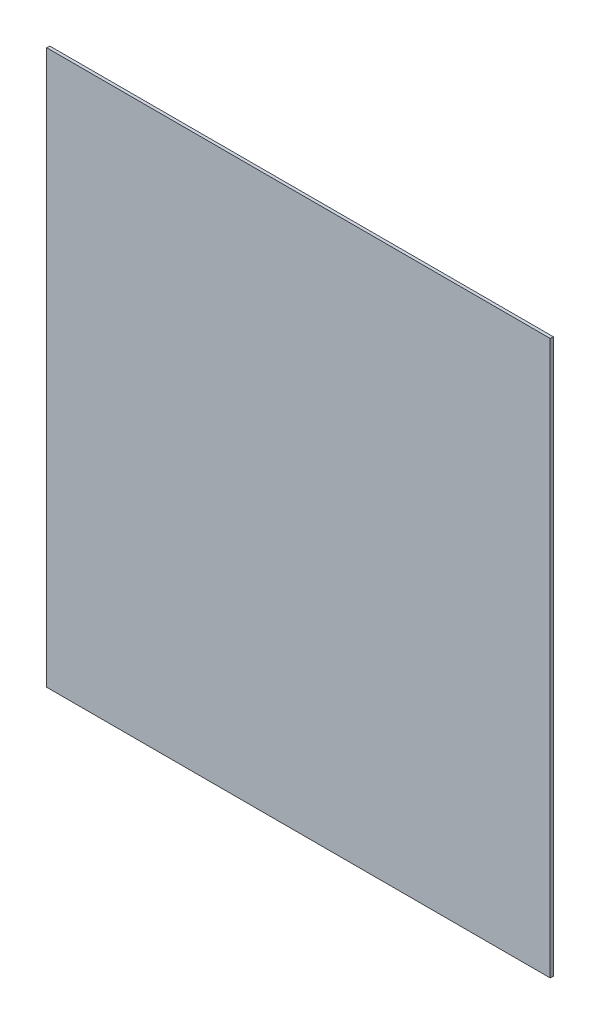
from build123d import *

# Parameters (mm, degrees)
SKETCH1_W           = 500
SKETCH1_H           = 550
BOSS_EXTRUDE1_DEPTH = 1.5


with BuildPart() as part:
    # Sketch1 → Boss-Extrude1 (new, symmetric)
    with BuildSketch(Plane.XY):
        Rectangle(SKETCH1_W, SKETCH1_H)
    extrude(amount=BOSS_EXTRUDE1_DEPTH, both=True)


solid = part.part
